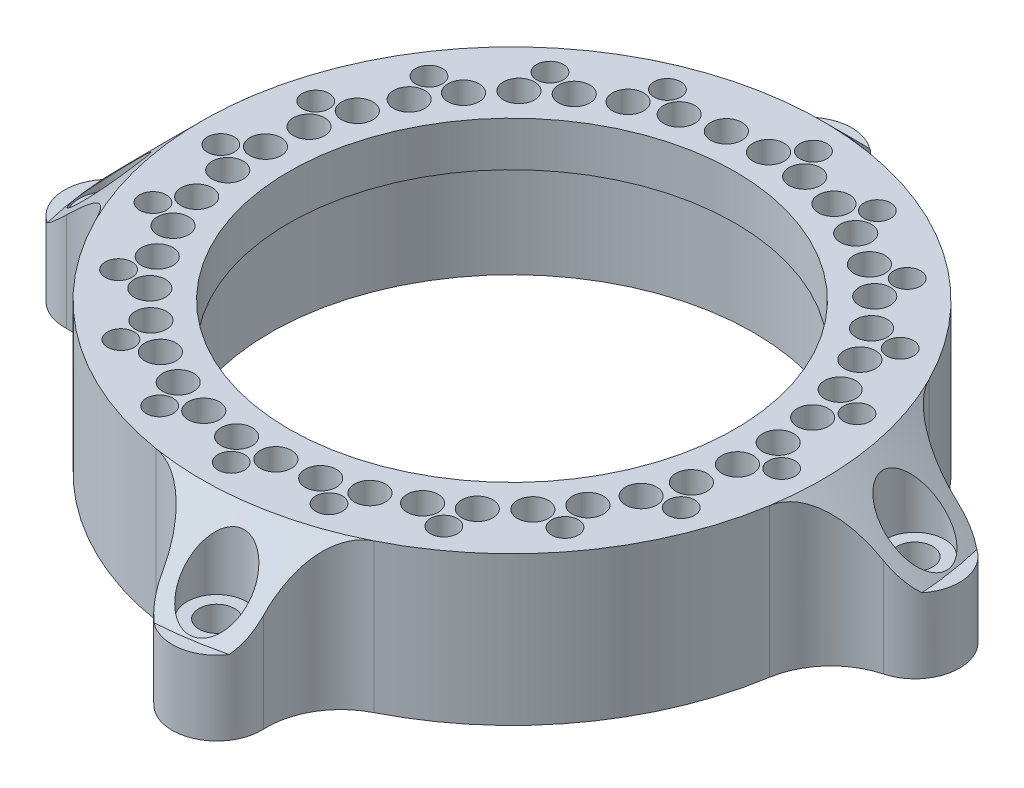
from build123d import *
from OCP.BRepAlgoAPI import BRepAlgoAPI_Cut
from OCP.TopTools import TopTools_ListOfShape

# Parameters (mm, degrees)
BOSS_EXTRUDE1_OUTLINE_R                              = 37
BOSS_EXTRUDE1_OUTLINE_R_2                            = 2.1
BOSS_EXTRUDE1_OUTLINE_R_3                            = 32
BOSS_EXTRUDE1_DEPTH                                  = 4
BOSS_EXTRUDE2_START                                  = -2
SKETCH2_R                                            = 37
SKETCH2_R_2                                          = 32
BOSS_EXTRUDE2_DEPTH                                  = 2
BOSS_EXTRUDE3_OUTLINE_W                              = 2
BOSS_EXTRUDE3_OUTLINE_H                              = 4
BOSS_EXTRUDE4_START                                  = 4
SKETCH4_R                                            = 37
SKETCH4_R_2                                          = 32.5
BOSS_EXTRUDE4_DEPTH                                  = 4
BOSS_EXTRUDE5_START                                  = 10
SKETCH5_R                                            = 40
SKETCH5_R_2                                          = 32.5
BOSS_EXTRUDE5_DEPTH                                  = 10
SKETCH6_R                                            = 40
SKETCH6_R_2                                          = 37
BOSS_EXTRUDE6_DEPTH                                  = 10
M3_CLEARANCE_HOLE1_D                                 = 3.4
SKETCH9_R                                            = 41.75
SKETCH9_R_2                                          = 40
BOSS_EXTRUDE7_DEPTH                                  = 20
CSK_FOR_M3_SOCKET_COUNTERSUNK_HEAD_SCREW_D           = 3.6
CSK_FOR_M3_SOCKET_COUNTERSUNK_HEAD_SCREW_CSINK_D     = 6.94
CSK_FOR_M3_SOCKET_COUNTERSUNK_HEAD_SCREW_CSINK_ANGLE = 90
SKETCH13_R                                           = 32
SKETCH13_R_2                                         = 30
BOSS_EXTRUDE8_DEPTH                                  = 2
SKETCH15_R                                           = 6
BOSS_EXTRUDE9_DEPTH                                  = 10
FILLET1_R                                            = 10
CHAMFER2_START                                       = -6
CHAMFER2_DEPTH                                       = 10.0000001
CBORE_FOR_M4_HEX_SOCKET_HEAD_CAP_SCREW1_D            = 4.8
CBORE_FOR_M4_HEX_SOCKET_HEAD_CAP_SCREW1_CBORE_D      = 8
CBORE_FOR_M4_HEX_SOCKET_HEAD_CAP_SCREW1_CBORE_DEPTH  = 10


with BuildPart() as part:
    # Boss-Extrude1: read off the stored shape, not the designer's step
    # Boss-Extrude1 outline → Boss-Extrude1 (new body)
    with BuildSketch(Plane(origin=(0, 0, 0), x_dir=(1, 0, 0), z_dir=(0, 1, 0))):
        Circle(BOSS_EXTRUDE1_OUTLINE_R)
        with Locations((-28.958107202, -18.753080475)):
            Circle(BOSS_EXTRUDE1_OUTLINE_R_2, mode=Mode.SUBTRACT)
        with Locations((-21.95036426, -26.616376704)):
            Circle(BOSS_EXTRUDE1_OUTLINE_R_2, mode=Mode.SUBTRACT)
        with Locations((-25.756086146, -22.953736656)):
            Circle(BOSS_EXTRUDE1_OUTLINE_R_2, mode=Mode.SUBTRACT)
        with Locations((-17.630144441, -29.655151441)):
            Circle(BOSS_EXTRUDE1_OUTLINE_R_2, mode=Mode.SUBTRACT)
        with Locations((-12.896688979, -31.998834563)):
            Circle(BOSS_EXTRUDE1_OUTLINE_R_2, mode=Mode.SUBTRACT)
        with Locations((-7.860946057, -33.592492124)):
            Circle(BOSS_EXTRUDE1_OUTLINE_R_2, mode=Mode.SUBTRACT)
        with Locations((-2.640949223, -34.398770141)):
            Circle(BOSS_EXTRUDE1_OUTLINE_R_2, mode=Mode.SUBTRACT)
        with Locations((-31.481374768, -14.112867982)):
            Circle(BOSS_EXTRUDE1_OUTLINE_R_2, mode=Mode.SUBTRACT)
        with Locations((-33.266745593, -9.141861826)):
            Circle(BOSS_EXTRUDE1_OUTLINE_R_2, mode=Mode.SUBTRACT)
        with Locations((-34.272372097, -3.956578176)):
            Circle(BOSS_EXTRUDE1_OUTLINE_R_2, mode=Mode.SUBTRACT)
        with Locations((2.640949223, -34.398770141)):
            Circle(BOSS_EXTRUDE1_OUTLINE_R_2, mode=Mode.SUBTRACT)
        with Locations((7.860946057, -33.592492124)):
            Circle(BOSS_EXTRUDE1_OUTLINE_R_2, mode=Mode.SUBTRACT)
        with Locations((12.896688979, -31.998834563)):
            Circle(BOSS_EXTRUDE1_OUTLINE_R_2, mode=Mode.SUBTRACT)
        with Locations((17.630144441, -29.655151441)):
            Circle(BOSS_EXTRUDE1_OUTLINE_R_2, mode=Mode.SUBTRACT)
        with Locations((21.95036426, -26.616376704)):
            Circle(BOSS_EXTRUDE1_OUTLINE_R_2, mode=Mode.SUBTRACT)
        with Locations((25.756086146, -22.953736656)):
            Circle(BOSS_EXTRUDE1_OUTLINE_R_2, mode=Mode.SUBTRACT)
        with Locations((28.958107202, -18.753080475)):
            Circle(BOSS_EXTRUDE1_OUTLINE_R_2, mode=Mode.SUBTRACT)
        with Locations((31.481374768, -14.112867982)):
            Circle(BOSS_EXTRUDE1_OUTLINE_R_2, mode=Mode.SUBTRACT)
        with Locations((33.266745593, -9.141861826)):
            Circle(BOSS_EXTRUDE1_OUTLINE_R_2, mode=Mode.SUBTRACT)
        with Locations((34.272372097, -3.956578176)):
            Circle(BOSS_EXTRUDE1_OUTLINE_R_2, mode=Mode.SUBTRACT)
        with Locations((-34.474683246, 1.321444312)):
            Circle(BOSS_EXTRUDE1_OUTLINE_R_2, mode=Mode.SUBTRACT)
        with Locations((-33.86893704, 6.568493266)):
            Circle(BOSS_EXTRUDE1_OUTLINE_R_2, mode=Mode.SUBTRACT)
        with Locations((-32.469331655, 11.661582305)):
            Circle(BOSS_EXTRUDE1_OUTLINE_R_2, mode=Mode.SUBTRACT)
        with Locations((-30.308672656, 16.481333739)):
            Circle(BOSS_EXTRUDE1_OUTLINE_R_2, mode=Mode.SUBTRACT)
        with Locations((-27.437604059, 20.914776678)):
            Circle(BOSS_EXTRUDE1_OUTLINE_R_2, mode=Mode.SUBTRACT)
        with Locations((-23.923421277, 24.857994979)):
            Circle(BOSS_EXTRUDE1_OUTLINE_R_2, mode=Mode.SUBTRACT)
        with Locations((-19.848493778, 28.218562946)):
            Circle(BOSS_EXTRUDE1_OUTLINE_R_2, mode=Mode.SUBTRACT)
        with Locations((-15.308334406, 30.917711715)):
            Circle(BOSS_EXTRUDE1_OUTLINE_R_2, mode=Mode.SUBTRACT)
        with Locations((-10.409360652, 32.892175526)):
            Circle(BOSS_EXTRUDE1_OUTLINE_R_2, mode=Mode.SUBTRACT)
        with Locations((-5.266400306, 34.09567462)):
            Circle(BOSS_EXTRUDE1_OUTLINE_R_2, mode=Mode.SUBTRACT)
        Circle(BOSS_EXTRUDE1_OUTLINE_R_3, mode=Mode.SUBTRACT)
        with Locations((34.474683246, 1.321444312)):
            Circle(BOSS_EXTRUDE1_OUTLINE_R_2, mode=Mode.SUBTRACT)
        with Locations((33.86893704, 6.568493266)):
            Circle(BOSS_EXTRUDE1_OUTLINE_R_2, mode=Mode.SUBTRACT)
        with Locations((32.469331655, 11.661582305)):
            Circle(BOSS_EXTRUDE1_OUTLINE_R_2, mode=Mode.SUBTRACT)
        with Locations((30.308672656, 16.481333739)):
            Circle(BOSS_EXTRUDE1_OUTLINE_R_2, mode=Mode.SUBTRACT)
        with Locations((0, 34.5)):
            Circle(BOSS_EXTRUDE1_OUTLINE_R_2, mode=Mode.SUBTRACT)
        with Locations((5.266400306, 34.09567462)):
            Circle(BOSS_EXTRUDE1_OUTLINE_R_2, mode=Mode.SUBTRACT)
        with Locations((15.308334406, 30.917711715)):
            Circle(BOSS_EXTRUDE1_OUTLINE_R_2, mode=Mode.SUBTRACT)
        with Locations((10.409360652, 32.892175526)):
            Circle(BOSS_EXTRUDE1_OUTLINE_R_2, mode=Mode.SUBTRACT)
        with Locations((27.437604059, 20.914776678)):
            Circle(BOSS_EXTRUDE1_OUTLINE_R_2, mode=Mode.SUBTRACT)
        with Locations((23.923421277, 24.857994979)):
            Circle(BOSS_EXTRUDE1_OUTLINE_R_2, mode=Mode.SUBTRACT)
        with Locations((19.848493778, 28.218562946)):
            Circle(BOSS_EXTRUDE1_OUTLINE_R_2, mode=Mode.SUBTRACT)
    extrude(amount=BOSS_EXTRUDE1_DEPTH)

    # Sketch2 → Boss-Extrude2 (add)
    with BuildSketch(Plane(origin=(0, 0, 0), x_dir=(1, 0, 0), z_dir=(0, 1, 0)).offset(BOSS_EXTRUDE2_START)):
        with Locations(Location((0, 0, 0), (0, 0, 270))):
            Circle(SKETCH2_R)
        with Locations(Location((0, 0, 0), (0, 0, 270))):
            Circle(SKETCH2_R_2, mode=Mode.SUBTRACT)
    extrude(amount=BOSS_EXTRUDE2_DEPTH)

    # Boss-Extrude3: read off the stored shape, not the designer's step
    # Boss-Extrude3 outline → Boss-Extrude3 (revolve)
    with BuildSketch(Plane.XY):
        with Locations((31, 0)):
            Rectangle(BOSS_EXTRUDE3_OUTLINE_W, BOSS_EXTRUDE3_OUTLINE_H)
    revolve(axis=Axis((0, 0, 0), (0, 1, 0)))

    # Sketch4 → Boss-Extrude4 (add)
    with BuildSketch(Plane.XZ.offset(2).offset(BOSS_EXTRUDE4_START)):
        with Locations(Location((0, 0, 0), (0, 0, 270))):
            Circle(SKETCH4_R)
        with Locations(Location((0, 0, 0), (0, 0, 270))):
            Circle(SKETCH4_R_2, mode=Mode.SUBTRACT)
    extrude(amount=-BOSS_EXTRUDE4_DEPTH)

    # Sketch5 → Boss-Extrude5 (add)
    with BuildSketch(Plane.XZ.offset(6).offset(BOSS_EXTRUDE5_START)):
        with Locations(Location((0, 0, 0), (0, 0, 270))):
            Circle(SKETCH5_R)
        with Locations(Location((0, 0, 0), (0, 0, 270))):
            Circle(SKETCH5_R_2, mode=Mode.SUBTRACT)
    extrude(amount=-BOSS_EXTRUDE5_DEPTH)

    # Sketch6 → Boss-Extrude6 (add)
    with BuildSketch(Plane(origin=(0, -6, 0), x_dir=(1, 0, 0), z_dir=(0, 1, 0))):
        with Locations(Location((0, 0, 0), (0, 0, 270))):
            Circle(SKETCH6_R)
        Circle(SKETCH6_R_2, mode=Mode.SUBTRACT)
    extrude(amount=BOSS_EXTRUDE6_DEPTH)

    # M3 Clearance Hole1 (through all)
    with Locations(Plane(origin=(0, 4, 0), x_dir=(1, 0, 0), z_dir=(0, 1, 0))):
        with Locations((-14.111594462, 35.013217529), (2.889734295, 37.639233995), (14.111594462, 35.013217529), (24.018152198, 29.123716538), (31.686044836, 20.519675013), (36.400569453, 10.003051708), (37.722298335, -1.445928197), (35.528036811, -12.76013716), (30.022305891, -22.885009264), (21.718279423, -30.876833369), (11.389952597, -35.9907138), (0, -37.75), (-11.389952597, -35.9907138), (-21.718279423, -30.876833369), (-30.022305891, -22.885009264), (-35.528036811, -12.76013716), (-37.722298335, -1.445928197), (-36.400569453, 10.003051708), (-31.686044836, 20.519675013), (-24.018152198, 29.123716538)):
            Hole(M3_CLEARANCE_HOLE1_D / 2)

    # Sketch9 → Boss-Extrude7 (add)
    with BuildSketch(Plane(origin=(0, -16, 0), x_dir=(1, 0, 0), z_dir=(0, 1, 0))):
        with Locations(Location((0, 0, 0), (0, 0, 90))):
            Circle(SKETCH9_R)
        Circle(SKETCH9_R_2, mode=Mode.SUBTRACT)
    extrude(amount=BOSS_EXTRUDE7_DEPTH)

    # CSK for M3 socket countersunk head screw1 (through all)
    with Locations(Plane(origin=(0, -16, 0), x_dir=(-1, 0, 0), z_dir=(0, -1, 0))):
        with Locations((14.111594462, 35.013217529), (24.017656287, 29.124125506), (31.685346016, 20.520754075), (36.400058422, 10.004911138), (37.72239673, -1.443358912), (35.529123055, -12.757112327), (30.024643795, -22.881941897), (21.721959578, -30.874244478), (11.394855176, -35.989161917), (0.005785128, -37.749999557), (-11.383824076, -35.992652714), (-21.712495699, -30.88090074), (-30.017629142, -22.891143281), (-35.525211372, -12.768001292), (-37.721952573, -1.45492064), (-36.403123186, 9.993754165), (-31.691634074, 20.511041653), (-24.026581612, 29.116762802), (-14.12232524, 35.008890725), (-2.901911355, 37.638297125)):
            CounterSinkHole(CSK_FOR_M3_SOCKET_COUNTERSUNK_HEAD_SCREW_D / 2, CSK_FOR_M3_SOCKET_COUNTERSUNK_HEAD_SCREW_CSINK_D / 2, counter_sink_angle=CSK_FOR_M3_SOCKET_COUNTERSUNK_HEAD_SCREW_CSINK_ANGLE)

    # Sketch13 → Boss-Extrude8 (add)
    with BuildSketch(Plane(origin=(0, 2, 0), x_dir=(1, 0, 0), z_dir=(0, 1, 0))):
        Circle(SKETCH13_R)
        with Locations(Location((0, 0, 0), (0, 0, 90))):
            Circle(SKETCH13_R_2, mode=Mode.SUBTRACT)
    extrude(amount=BOSS_EXTRUDE8_DEPTH)

    # Sketch15 → Boss-Extrude9 (add)
    with BuildSketch(Plane.XZ.offset(16)):
        with Locations((-7.24324725, -46.944492428)):
            Circle(SKETCH15_R)
        with Locations((-46.944492428, 7.24324725)):
            Circle(SKETCH15_R)
        with Locations((7.24324725, 46.944492428)):
            Circle(SKETCH15_R)
        with Locations((46.944492428, -7.24324725)):
            Circle(SKETCH15_R)
    extrude(amount=-BOSS_EXTRUDE9_DEPTH)

    # Fillet1
    # the kernel refuses this fillet: 10 mm, written as the material it adds along each edge
    with BuildSketch(Plane(origin=(-7.949463816, -6, -40.986199202), x_dir=(-0.6803946551285537, 0, -0.7328459000857525), z_dir=(0, -1, 0)), Plane(origin=(-40.986199202, -6, 7.949463816), x_dir=(-0.732845900085733, 0, 0.6803946551285746), z_dir=(0, -1, 0)), Plane(origin=(7.949463816, -6, 40.986199202), x_dir=(0.6803946551285863, 0, 0.7328459000857221), z_dir=(0, -1, 0)), Plane(origin=(40.986199202, -6, -7.949463816), x_dir=(0.7328459000857467, 0, -0.6803946551285598), z_dir=(0, -1, 0))) as fillet1_piece_1:
        with BuildLine():
            CenterArc((14.24868421, -7.6192313), FILLET1_R, 130.365968644, 65.838686847)
            ThreePointArc((4.645974075, -10.409922624), (2.679955395, -5.045645456), (0, 0))
            ThreePointArc((0, 0), (3.886004784, -1.42846122), (7.772009569, 0))
        make_face()
    extrude(amount=10)
    with BuildSketch(Plane(origin=(-4.773972135, -6, -41.476158092), x_dir=(0.42786354352526534, 0, -0.9038433426883241), z_dir=(0, -1, 0)), Plane(origin=(-41.476158092, -6, 4.773972135), x_dir=(-0.9038433426883272, 0, -0.4278635435252588), z_dir=(0, -1, 0)), Plane(origin=(4.773972135, -6, 41.476158092), x_dir=(-0.4278635435252675, 0, 0.9038433426883231), z_dir=(0, -1, 0)), Plane(origin=(41.476158092, -6, -4.773972135), x_dir=(0.9038433426883294, 0, 0.4278635435252539), z_dir=(0, -1, 0))) as fillet1_piece_2:
        with BuildLine():
            CenterArc((14.24868421, 7.6192313), FILLET1_R, 163.795344509, 65.838686847)
            ThreePointArc((4.645974075, 10.409922624), (2.679955395, 5.045645456), (0, 0))
            ThreePointArc((0, 0), (3.886004784, 1.42846122), (7.772009569, 0))
        make_face()
    extrude(amount=10)


with BuildPart() as chamfer2_tool:
    # Chamfer2: read off the stored shape, not the designer's step
    # Chamfer2 outline → Chamfer2 (new body)
    with BuildSketch(Plane(origin=(0, 0, 0), x_dir=(1, 0, 0), z_dir=(0, 1, 0)).offset(CHAMFER2_START)):
        with BuildLine():
            ThreePointArc((-46.68188455, -13.237497587), (-41.182238155, -14.603734034), (-37.308126541, -18.73942886))
            ThreePointArc((-37.308126541, -18.73942886), (-41.261738081, -6.366433109), (-41.221364448, 6.622810058))
            ThreePointArc((-41.221364448, 6.622810058), (-43.668757847, 1.51174578), (-48.5008372, -1.448612581))
            ThreePointArc((-48.5008372, -1.448612581), (-52.87432305, -8.158183745), (-46.68188455, -13.237497587))
        make_face()
        with BuildLine():
            ThreePointArc((18.73942886, -37.308126541), (6.366433109, -41.261738081), (-6.622810058, -41.221364448))
            ThreePointArc((-6.622810058, -41.221364448), (-1.51174578, -43.668757847), (1.448612581, -48.5008372))
            ThreePointArc((1.448612581, -48.5008372), (8.158183745, -52.87432305), (13.237497587, -46.68188455))
            ThreePointArc((13.237497587, -46.68188455), (14.603734034, -41.182238155), (18.73942886, -37.308126541))
        make_face()
        with BuildLine():
            ThreePointArc((-13.237497587, 46.68188455), (-14.603734034, 41.182238155), (-18.73942886, 37.308126541))
            ThreePointArc((-18.73942886, 37.308126541), (-6.366433109, 41.261738081), (6.622810058, 41.221364448))
            ThreePointArc((6.622810058, 41.221364448), (1.51174578, 43.668757847), (-1.448612581, 48.5008372))
            ThreePointArc((-1.448612581, 48.5008372), (-8.158183745, 52.87432305), (-13.237497587, 46.68188455))
        make_face()
        with BuildLine():
            ThreePointArc((37.308126541, 18.73942886), (41.261738081, 6.366433109), (41.221364448, -6.622810058))
            ThreePointArc((41.221364448, -6.622810058), (43.668757847, -1.51174578), (48.5008372, 1.448612581))
            ThreePointArc((48.5008372, 1.448612581), (52.87432305, 8.158183745), (46.68188455, 13.237497587))
            ThreePointArc((46.68188455, 13.237497587), (41.182238155, 14.603734034), (37.308126541, 18.73942886))
        make_face()
    extrude(amount=CHAMFER2_DEPTH)


with BuildPart() as part_1:
    add(part.part)


with BuildPart() as part_2:
    # Chamfer2: joined with chamfer2_tool
    add(part_1.part.fuse(chamfer2_tool.part, tol=0.00001))


with BuildPart() as chamfer2_2_tool:
    # Chamfer2 2 outline → Chamfer2 2 (revolve)
    with BuildSketch(Plane.XY):
        Polygon((41.749998671, 4.000001329), (51.75, -6), (53.5, -6), (53.5, 4.000001329), align=None)
    revolve(axis=Axis((0, 0, 0), (0, 1, 0)))


with BuildPart() as part_3:
    add(part_2.part)

    # Chamfer2 2: cut by chamfer2_2_tool, with a tolerance
    chamfer2_2_stock = TopTools_ListOfShape()
    chamfer2_2_stock.Append(part_3.part.wrapped)
    chamfer2_2_tools = TopTools_ListOfShape()
    chamfer2_2_tools.Append(chamfer2_2_tool.part.wrapped)
    chamfer2_2_cut = BRepAlgoAPI_Cut()
    chamfer2_2_cut.SetArguments(chamfer2_2_stock)
    chamfer2_2_cut.SetTools(chamfer2_2_tools)
    chamfer2_2_cut.SetFuzzyValue(0.00001)
    chamfer2_2_cut.Build()
    add(Compound.cast(chamfer2_2_cut.Shape()).solids(), mode=Mode.REPLACE)

    # CBORE for M4 Hex Socket Head Cap Screw1 (through all)
    with Locations(Plane(origin=(0, 4, 0), x_dir=(1, 0, 0), z_dir=(0, 1, 0))):
        with Locations((-46.944492428, -7.24324725), (-7.24324725, 46.944492428), (46.944492428, 7.24324725), (7.24324725, -46.944492428)):
            CounterBoreHole(CBORE_FOR_M4_HEX_SOCKET_HEAD_CAP_SCREW1_D / 2, CBORE_FOR_M4_HEX_SOCKET_HEAD_CAP_SCREW1_CBORE_D / 2, CBORE_FOR_M4_HEX_SOCKET_HEAD_CAP_SCREW1_CBORE_DEPTH)


solid = part_3.part
